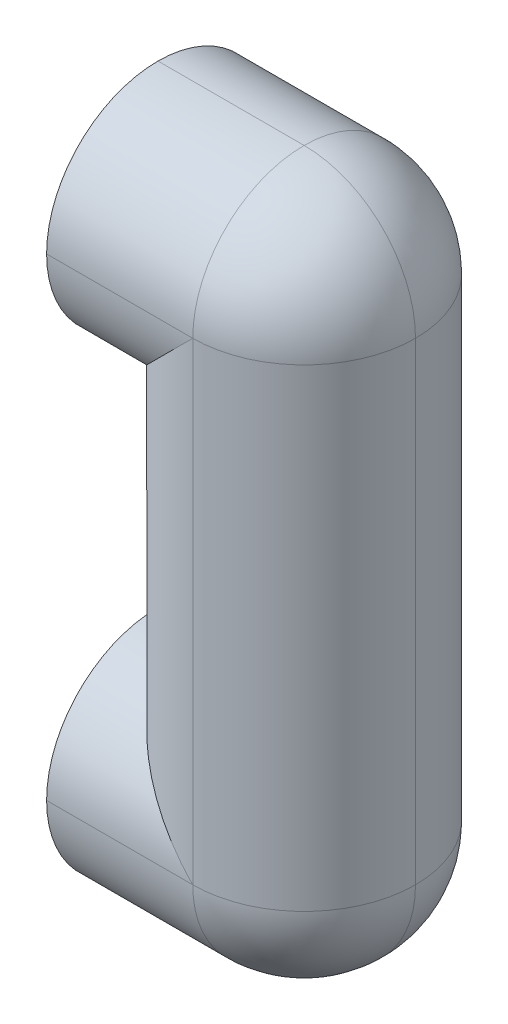
from build123d import *

# Parameters (mm, degrees)
SKETCH1_W           = 48
SKETCH1_H           = 48
BOSS_EXTRUDE1_DEPTH = 75
SKETCH2_W           = 48
SKETCH2_H           = 48
BOSS_EXTRUDE2_DEPTH = 7.5
FILLET1_R           = 24
SKETCH3_R           = 5
CUT_EXTRUDE1_DEPTH  = 15
SKETCH4_R           = 5
BOSS_EXTRUDE3_DEPTH = 7.5


with BuildPart() as part:
    # Sketch1 → Boss-Extrude1 (new, symmetric)
    with BuildSketch(Plane(origin=(0, 0, 0), x_dir=(1, 0, 0), z_dir=(0, 1, 0))):
        with Locations((24, 24)):
            Rectangle(SKETCH1_W, SKETCH1_H)
    extrude(amount=BOSS_EXTRUDE1_DEPTH, both=True)

    # Sketch2 → Boss-Extrude2 (add, symmetric)
    with BuildSketch(Plane.ZY):
        with Locations((-24, 51)):
            Rectangle(SKETCH2_W, SKETCH2_H)
        with Locations((-24, -51)):
            Rectangle(SKETCH2_W, SKETCH2_H)
    extrude(amount=BOSS_EXTRUDE2_DEPTH, both=True)

    # Fillet1
    fillet1_edges = [part.edges().sort_by_distance(p)[0] for p in [
        (48, 75, -24),
        (0, 0, -48),
        (20.25, 75, -48),
        (0, 0, 0),
        (-3.75, 27, -48),
        (-3.75, 27, 0),
        (-3.75, -27, 0),
        (-3.75, -27, -48),
        (20.25, -75, -48),
        (48, -75, -24),
        (20.25, -75, 0),
        (48, 0, -48),
        (48, 0, 0),
        (20.25, 75, 0),
    ]]
    fillet(fillet1_edges, radius=FILLET1_R - 0.0001)  # a hair under: the kernel refuses the full size

    # Sketch3 → Cut-Extrude1 (cut)
    with BuildSketch(Plane.ZY.offset(7.5)):
        with Locations((-24, -51)):
            Circle(SKETCH3_R)
    extrude(amount=-CUT_EXTRUDE1_DEPTH, mode=Mode.SUBTRACT)

    # Sketch4 → Boss-Extrude3 (add, symmetric)
    with BuildSketch(Plane.ZY.offset(7.5)):
        with Locations((-24, 51)):
            Circle(SKETCH4_R)
    extrude(amount=BOSS_EXTRUDE3_DEPTH, both=True)


solid = part.part
